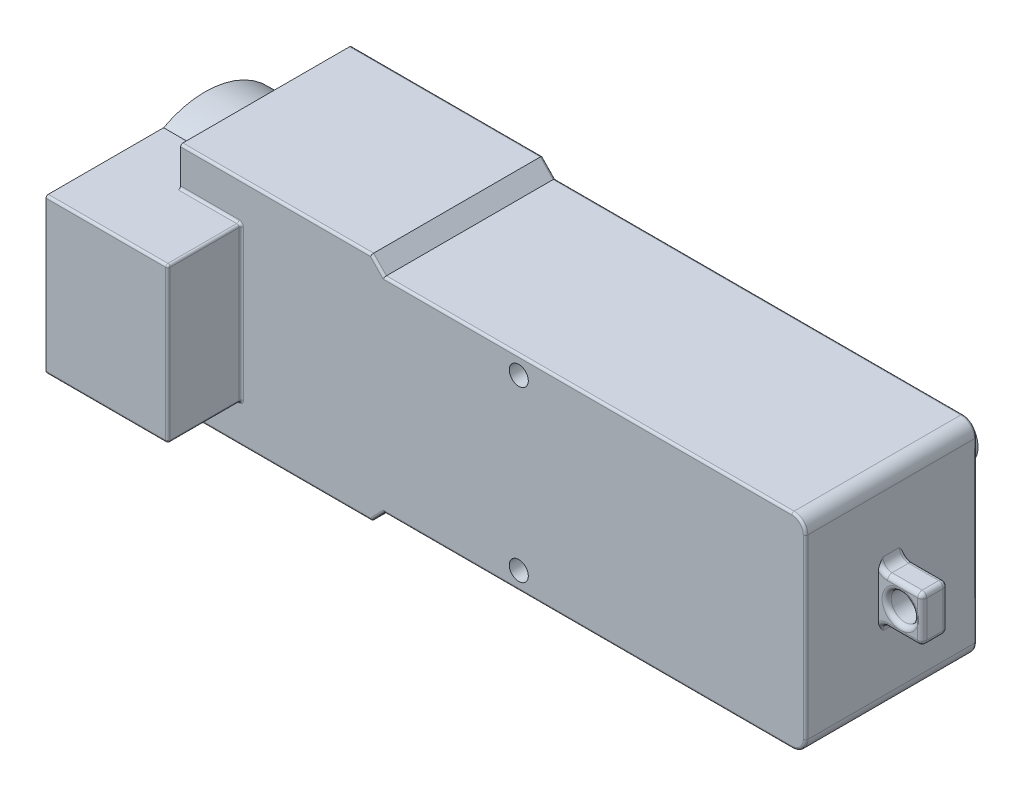
from build123d import *

# Parameters (mm, degrees)
BOSS_EXTRUDE1_DEPTH      = 187.5
CUT_EXTRUDE5_DEPTH       = 67
SKETCH4_W                = 80.4
SKETCH4_H                = 169
BOSS_EXTRUDE2_DEPTH      = 133.5
BOSS_EXTRUDE3_DEPTH      = 14
BOSS_EXTRUDE3_DEPTH_BACK = 14
BOSS_EXTRUDE3_START      = -93.75
SKETCH5_W                = 48
SKETCH5_H                = 50
SKETCH5_R                = 14.95
SCALE1_SCALE             = 0.1
CUT_EXTRUDE6_REACH       = 91.79
SKETCH6_R                = 1.043257281
BOSS_EXTRUDE4_DEPTH      = 8.85
SKETCH8_R                = 1.99
BOSS_EXTRUDE5_DEPTH      = 1.77
FILLET1_R                = 1
FILLET2_R                = 0.5
FILLET3_R                = 0.25


with BuildPart() as part:
    # Sketch1 → Boss-Extrude1 (new body)
    with BuildSketch(Plane.XY):
        with BuildLine():
            Line((-342.25, 126.5), (-342.25, 96))
            Line((-342.25, 96), (-409.25, 96))
            Line((-409.25, 96), (-409.25, -96))
            Line((-409.25, -96), (-342.25, -96))
            Line((-342.25, -96), (-342.25, -126.5))
            Line((-342.25, -126.5), (-133.25, -126.5))
            Line((-133.25, -126.5), (-119.25, -112))
            Line((-119.25, -112), (327.25, -112))
            ThreePointArc((327.25, -112), (337.856601718, -107.606601718), (342.25, -97))
            Line((342.25, -97), (342.25, 97))
            ThreePointArc((342.25, 97), (337.856601718, 107.606601718), (327.25, 112))
            Line((327.25, 112), (-119.25, 112))
            Line((-119.25, 112), (-133.25, 126.5))
            Line((-133.25, 126.5), (-342.25, 126.5))
        make_face()
    extrude(amount=BOSS_EXTRUDE1_DEPTH)

    # Sketch3 → Cut-Extrude5 (cut)
    with BuildSketch(Plane.ZY.offset(409.25)):
        with BuildLine():
            Line((187.5, 96), (0, 96))
            Line((0, 96), (0, -96))
            Line((0, -96), (187.5, -96))
            Line((187.5, -96), (187.5, -84.5))
            Line((187.5, -84.5), (139.09931091, -84.5))
            ThreePointArc((139.09931091, -84.5), (66.815124203, -92.039787406), (10, -46.719883347))
            Line((10, -46.719883347), (10, 46.719883347))
            ThreePointArc((10, 46.719883347), (66.815124203, 92.039787406), (139.09931091, 84.5))
            Line((139.09931091, 84.5), (187.5, 84.5))
            Line((187.5, 84.5), (187.5, 96))
        make_face()
    extrude(amount=-CUT_EXTRUDE5_DEPTH, mode=Mode.SUBTRACT)

    # Sketch4 → Boss-Extrude2 (add)
    with BuildSketch(Plane.ZY.offset(409.25)):
        with Locations((227.7, 0)):
            Rectangle(SKETCH4_W, SKETCH4_H)
    extrude(amount=-BOSS_EXTRUDE2_DEPTH)

    # Sketch5 → Boss-Extrude3 (add, two sides: drawn at the far end of the back side and taken through both)
    with BuildSketch(Plane(origin=(0, 0, 0), x_dir=(-1, 0, 0), z_dir=(0, 0, -1)).offset(BOSS_EXTRUDE3_START - BOSS_EXTRUDE3_DEPTH_BACK)):
        with Locations((-366.25, 0)):
            Rectangle(SKETCH5_W, SKETCH5_H)
        with Locations((-366.25, 0)):
            Circle(SKETCH5_R, mode=Mode.SUBTRACT)
    extrude(amount=BOSS_EXTRUDE3_DEPTH + BOSS_EXTRUDE3_DEPTH_BACK)


with BuildPart() as part_1:
    # Scale1: scaled about (-48.707387948, 0, 101.405707756)
    add(part.part.scale(SCALE1_SCALE).moved(Location((-43.836649153, 0, 91.26513698))))

    # Sketch6 → Cut-Extrude6 (cut, up to next)
    with BuildSketch(Plane(origin=(0, 0, 91.26513698), x_dir=(-1, 0, 0), z_dir=(0, 0, -1)), mode=Mode.PRIVATE) as cut_extrude6_sk1:
        with Locations((41.021649153, 9.256742719)):
            Circle(SKETCH6_R)
    cut_extrude6_tool1 = extrude(cut_extrude6_sk1.sketch, amount=-CUT_EXTRUDE6_REACH, mode=Mode.PRIVATE) & part_1.part
    # Sketch6 → Cut-Extrude6 (cut, up to next)
    with BuildSketch(Plane(origin=(0, 0, 91.26513698), x_dir=(-1, 0, 0), z_dir=(0, 0, -1)), mode=Mode.PRIVATE) as cut_extrude6_sk2:
        with Locations(Location((41.021649153, -9.256742719, 0), (0, 0, 180))):
            Circle(SKETCH6_R)
    cut_extrude6_tool2 = extrude(cut_extrude6_sk2.sketch, amount=-CUT_EXTRUDE6_REACH, mode=Mode.PRIVATE) & part_1.part
    add(cut_extrude6_tool1.solids().sort_by_distance((-41.021649, 9.256743, 91.265137))[0], mode=Mode.SUBTRACT)
    add(cut_extrude6_tool2.solids().sort_by_distance((-41.021649, -9.256743, 91.265137))[0], mode=Mode.SUBTRACT)

    # Sketch7 → Boss-Extrude4 (add)
    with BuildSketch(Plane(origin=(0, 0, 91.26513698), x_dir=(-1, 0, 0), z_dir=(0, 0, -1))):
        with BuildLine():
            Line((19.055053109, 1.85), (22.988245197, 1.85))
            ThreePointArc((22.988245197, 1.85), (23.721649153, 0), (22.988245197, -1.85))
            Line((22.988245197, -1.85), (19.055053109, -1.85))
            ThreePointArc((19.055053109, -1.85), (18.321649153, 0), (19.055053109, 1.85))
        make_face()
    extrude(amount=BOSS_EXTRUDE4_DEPTH)

    # Sketch8 → Boss-Extrude5 (add)
    with BuildSketch(Plane(origin=(0, 0, 91.26513698), x_dir=(-1, 0, 0), z_dir=(0, 0, -1))):
        with Locations(Location((32.021649153, 0, 0), (0, 0, 180))):
            Circle(SKETCH8_R)
    extrude(amount=BOSS_EXTRUDE5_DEPTH)

    # Fillet1
    fillet1_edges = [part_1.edges().sort_by_distance(p)[0] for p in [
        (-9.611649153, 2.5, 100.64013698),
        (-9.611649153, -2.5, 100.64013698),
    ]]
    fillet(fillet1_edges, radius=FILLET1_R)

    # Fillet2
    # the kernel refuses this fillet: 0.5 mm, written as the material it takes off along each edge
    with BuildSketch(Plane(origin=(-5.311649153, 2, 99.74013698), x_dir=(0, 0, -1), z_dir=(0, 1, 0))) as fillet2_piece_1_section:
        Polygon((0, 0), (FILLET2_R * 1.02, 0), (FILLET2_R * 1.02, -FILLET2_R * 1.02), (0, -FILLET2_R * 1.02), align=None)
    fillet2_piece_1 = extrude(amount=FILLET2_R * 1.02, mode=Mode.PRIVATE)
    fillet2_piece_1 = fillet2_piece_1 - Plane(origin=(-5.311649153, 2, 99.74013698), x_dir=(-0.7071067811865475, 0, 0.7071067811865475), z_dir=(0, 1, 0)) * Sphere(FILLET2_R, mode=Mode.PRIVATE)
    add(fillet2_piece_1, mode=Mode.SUBTRACT)
    with BuildSketch(Plane(origin=(-5.311649153, 2, 101.54013698), x_dir=(0, 0, 1), z_dir=(0, 1, 0))) as fillet2_piece_2_section:
        Polygon((0, 0), (FILLET2_R * 1.02, 0), (FILLET2_R * 1.02, FILLET2_R * 1.02), (0, FILLET2_R * 1.02), align=None)
    fillet2_piece_2 = extrude(amount=FILLET2_R * 1.02, mode=Mode.PRIVATE)
    fillet2_piece_2 = fillet2_piece_2 - Plane(origin=(-5.311649153, 2, 101.54013698), x_dir=(-0.7071067811865475, 0, -0.7071067811865475), z_dir=(0, 1, 0)) * Sphere(FILLET2_R, mode=Mode.PRIVATE)
    add(fillet2_piece_2, mode=Mode.SUBTRACT)
    with BuildSketch(Plane(origin=(-5.311649153, -2, 101.54013698), x_dir=(0, -1, 0), z_dir=(0, 0, 1))) as fillet2_piece_3_section:
        Polygon((0, 0), (FILLET2_R * 1.02, 0), (FILLET2_R * 1.02, FILLET2_R * 1.02), (0, FILLET2_R * 1.02), align=None)
    fillet2_piece_3 = extrude(amount=FILLET2_R * 1.02, mode=Mode.PRIVATE)
    fillet2_piece_3 = fillet2_piece_3 - Plane(origin=(-5.311649153, -2, 101.54013698), x_dir=(-0.7071067811865475, 0.7071067811865475, 0), z_dir=(0, 0, 1)) * Sphere(FILLET2_R, mode=Mode.PRIVATE)
    add(fillet2_piece_3, mode=Mode.SUBTRACT)
    with BuildSketch(Plane(origin=(-5.311649153, -2, 99.74013698), x_dir=(0, -1, 0), z_dir=(0, 0, -1))) as fillet2_piece_4_section:
        Polygon((0, 0), (FILLET2_R * 1.02, 0), (FILLET2_R * 1.02, -FILLET2_R * 1.02), (0, -FILLET2_R * 1.02), align=None)
    fillet2_piece_4 = extrude(amount=FILLET2_R * 1.02, mode=Mode.PRIVATE)
    fillet2_piece_4 = fillet2_piece_4 - Plane(origin=(-5.311649153, -2, 99.74013698), x_dir=(-0.7071067811865475, 0.7071067811865475, 0), z_dir=(0, 0, -1)) * Sphere(FILLET2_R, mode=Mode.PRIVATE)
    add(fillet2_piece_4, mode=Mode.SUBTRACT)
    with BuildSketch(Plane(origin=(-8.611649153, 2.5, 99.24013698), x_dir=(0, 0, 1), z_dir=(1, 0, 0)), Plane(origin=(-5.311649153, -2.5, 99.24013698), x_dir=(0, 0, 1), z_dir=(-1, 0, 0))) as fillet2_piece_5:
        with BuildLine():
            CenterArc((FILLET2_R, FILLET2_R), FILLET2_R, 180, 90)
            Line((0, FILLET2_R), (0, 0))
            Line((0, 0), (FILLET2_R, 0))
        make_face()
    extrude(amount=3.3, mode=Mode.SUBTRACT)
    with BuildSketch(Plane(origin=(-8.611649153, 2.5, 102.04013698), x_dir=(0, 0, -1), z_dir=(1, 0, 0)), Plane(origin=(-5.311649153, -2.5, 102.04013698), x_dir=(0, 0, -1), z_dir=(-1, 0, 0))) as fillet2_piece_6:
        with BuildLine():
            CenterArc((FILLET2_R, -FILLET2_R), FILLET2_R, 90, 90)
            Line((0, -FILLET2_R), (0, 0))
            Line((0, 0), (FILLET2_R, 0))
        make_face()
    extrude(amount=3.3, mode=Mode.SUBTRACT)
    with BuildSketch(Plane(origin=(-8.611649153, 3.5, 99.24013698), x_dir=(-0.3148458040869783, 0.9491428341660828, 0), z_dir=(0.9491428341660828, 0.3148458040869783, 0))) as fillet2_piece_7_section:
        with BuildLine():
            CenterArc((1 + FILLET2_R, FILLET2_R), FILLET2_R, 180, 90)
            Line((1 + FILLET2_R, 0), (1, 0))
            Line((1, 0), (1, FILLET2_R))
        make_face()
    fillet2_piece_7 = revolve(axis=Axis((-8.611649153, 3.5, 99.24013698), (0, 0, 1)), revolution_arc=161.648494619, mode=Mode.PRIVATE)
    fillet2_piece_7 = split(fillet2_piece_7, bisect_by=Plane(origin=(-9.611649153, 2.768902145, 99.376212943), z_dir=(1, 0, 0)), keep=Keep.TOP, mode=Mode.PRIVATE)
    add(fillet2_piece_7, mode=Mode.SUBTRACT)
    with BuildSketch(Plane(origin=(-8.611649153, 3.5, 102.04013698), x_dir=(-0.3148458040869783, 0.9491428341660828, 0), z_dir=(0.9491428341660828, 0.3148458040869783, 0))) as fillet2_piece_8_section:
        with BuildLine():
            CenterArc((1 + FILLET2_R, -FILLET2_R), FILLET2_R, 90, 90)
            Line((1, -FILLET2_R), (1, 0))
            Line((1, 0), (1 + FILLET2_R, 0))
        make_face()
    fillet2_piece_8 = revolve(axis=Axis((-8.611649153, 3.5, 102.04013698), (0, 0, 1)), revolution_arc=161.648494619, mode=Mode.PRIVATE)
    fillet2_piece_8 = split(fillet2_piece_8, bisect_by=Plane(origin=(-9.611649153, 2.768902126, 101.904061011), z_dir=(1, 0, 0)), keep=Keep.TOP, mode=Mode.PRIVATE)
    add(fillet2_piece_8, mode=Mode.SUBTRACT)
    with BuildSketch(Plane(origin=(-8.611649153, -3.5, 99.24013698), x_dir=(-0.3148458040869783, -0.9491428341660828, 0), z_dir=(0.9491428341660828, -0.3148458040869783, 0))) as fillet2_piece_9_section:
        with BuildLine():
            CenterArc((1 + FILLET2_R, -FILLET2_R), FILLET2_R, 90, 90)
            Line((1 + FILLET2_R, 0), (1, 0))
            Line((1, 0), (1, -FILLET2_R))
        make_face()
    fillet2_piece_9 = revolve(axis=Axis((-8.611649153, -3.5, 99.24013698), (0, 0, -1)), revolution_arc=161.648494619, mode=Mode.PRIVATE)
    fillet2_piece_9 = split(fillet2_piece_9, bisect_by=Plane(origin=(-9.611649153, -2.768901858, 99.376212516), z_dir=(1, 0, 0)), keep=Keep.TOP, mode=Mode.PRIVATE)
    add(fillet2_piece_9, mode=Mode.SUBTRACT)
    with BuildSketch(Plane(origin=(-8.611649153, -3.5, 102.04013698), x_dir=(-0.3148458040869783, -0.9491428341660828, 0), z_dir=(0.9491428341660828, -0.3148458040869783, 0))) as fillet2_piece_10_section:
        with BuildLine():
            CenterArc((1 + FILLET2_R, FILLET2_R), FILLET2_R, 180, 90)
            Line((1 + FILLET2_R, 0), (1, 0))
            Line((1, 0), (1, FILLET2_R))
        make_face()
    fillet2_piece_10 = revolve(axis=Axis((-8.611649153, -3.5, 102.04013698), (0, 0, -1)), revolution_arc=161.648494619, mode=Mode.PRIVATE)
    fillet2_piece_10 = split(fillet2_piece_10, bisect_by=Plane(origin=(-9.611649153, -2.768901858, 101.904061445), z_dir=(1, 0, 0)), keep=Keep.TOP, mode=Mode.PRIVATE)
    add(fillet2_piece_10, mode=Mode.SUBTRACT)
    with BuildSketch(Plane(origin=(-4.811649153, -2.5, 101.54013698), x_dir=(-1, 0, 0), z_dir=(0, 0, -1)), Plane(origin=(-4.811649153, 2.5, 101.54013698), x_dir=(0, -1, 0), z_dir=(0, 0, -1))) as fillet2_piece_11:
        with BuildLine():
            CenterArc((FILLET2_R, FILLET2_R), FILLET2_R, 180, 90)
            Line((0, FILLET2_R), (0, 0))
            Line((0, 0), (FILLET2_R, 0))
        make_face()
    extrude(amount=1.8, mode=Mode.SUBTRACT)
    with BuildSketch(Plane(origin=(-4.811649153, 2, 102.04013698), x_dir=(0, 0, -1), z_dir=(0, -1, 0))) as fillet2_piece_12:
        with BuildLine():
            CenterArc((FILLET2_R, -FILLET2_R), FILLET2_R, 90, 90)
            Line((0, -FILLET2_R), (0, 0))
            Line((0, 0), (FILLET2_R, 0))
        make_face()
    extrude(amount=4, mode=Mode.SUBTRACT)
    with BuildSketch(Plane(origin=(-7.211649153, 0, 102.04013698), x_dir=(-1, 0, 0), z_dir=(0, -1, 0))) as fillet2_piece_13:
        with BuildLine():
            CenterArc((1.495 + FILLET2_R, FILLET2_R), FILLET2_R, 180, 90)
            Line((1.495, FILLET2_R), (1.495, 0))
            Line((1.495, 0), (1.495 + FILLET2_R, 0))
        make_face()
    revolve(axis=Axis((-7.211649153, 0, 102.04013698), (0, 0, -1)), mode=Mode.SUBTRACT)
    with BuildSketch(Plane(origin=(-7.211649153, 0, 99.24013698), x_dir=(-1, 0, 0), z_dir=(0, -1, 0))) as fillet2_piece_14:
        with BuildLine():
            CenterArc((1.495 + FILLET2_R, -FILLET2_R), FILLET2_R, 90, 90)
            Line((1.495 + FILLET2_R, 0), (1.495, 0))
            Line((1.495, 0), (1.495, -FILLET2_R))
        make_face()
    revolve(axis=Axis((-7.211649153, 0, 99.24013698), (0, 0, -1)), mode=Mode.SUBTRACT)
    with BuildSketch(Plane(origin=(-4.811649153, 2, 99.24013698), x_dir=(0, 0, 1), z_dir=(0, -1, 0))) as fillet2_piece_15:
        with BuildLine():
            CenterArc((FILLET2_R, FILLET2_R), FILLET2_R, 180, 90)
            Line((0, FILLET2_R), (0, 0))
            Line((0, 0), (FILLET2_R, 0))
        make_face()
    extrude(amount=4, mode=Mode.SUBTRACT)

    # Fillet3
    fillet3_edges = [part_1.edges().sort_by_distance(p)[0] for p in [
        (-78.061649153, -8.45, 107.595102526),
        (-74.736649153, 8.45, 110.01513698),
        (-74.736649153, -8.45, 110.01513698),
        (-33.436649153, -11.2, 110.01513698),
        (-10.050988981, -10.760660172, 110.01513698),
        (-9.611649153, 0, 110.01513698),
        (-10.050988981, 10.760660172, 110.01513698),
        (-33.436649153, 11.2, 91.26513698),
        (-10.050988981, 10.760660172, 91.26513698),
        (-9.611649153, 0, 91.26513698),
        (-10.050988981, -10.760660172, 91.26513698),
        (-71.411649153, 0, 110.01513698),
        (-71.411649153, -8.45, 114.03513698),
        (-71.411649153, 8.45, 114.03513698),
        (-78.086649153, -8.45, 118.05513698),
        (-78.086649153, 8.45, 118.05513698),
        (-71.411649153, 0, 118.05513698),
        (-78.061649153, -10.55, 110.01513698),
        (-67.611649153, -12.65, 110.01513698),
        (-56.461649153, -11.925, 110.01513698),
        (-33.436649153, 11.2, 110.01513698),
        (-56.461649153, 11.925, 110.01513698),
        (-67.611649153, 12.65, 110.01513698),
        (-67.611649153, 12.65, 91.26513698),
        (-56.461649153, 11.925, 91.26513698),
        (-78.061649153, 0, 91.26513698),
        (-67.611649153, -12.65, 91.26513698),
        (-56.461649153, -11.925, 91.26513698),
        (-33.436649153, -11.2, 91.26513698),
    ]]
    fillet(fillet3_edges, radius=FILLET3_R)


solid = part_1.part
